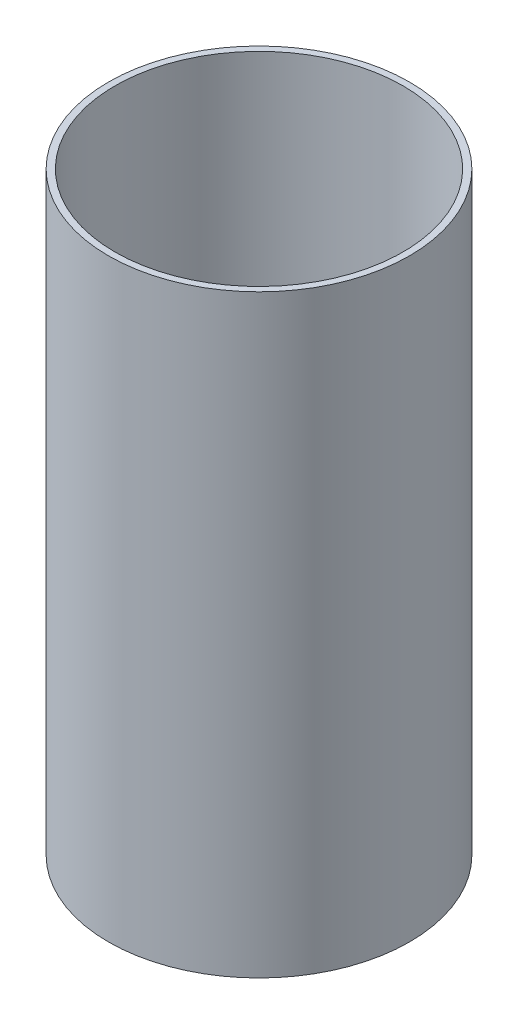
from build123d import *

# Parameters (mm, degrees)
ESQUISSE1_R        = 76
ESQUISSE1_R_2      = 72.7
BOSS_EXTRU_1_DEPTH = 300


with BuildPart() as part:
    # Esquisse1 → Boss.-Extru.1 (new body)
    with BuildSketch(Plane(origin=(0, 0, 0), x_dir=(1, 0, 0), z_dir=(0, 1, 0))):
        Circle(ESQUISSE1_R)
        Circle(ESQUISSE1_R_2, mode=Mode.SUBTRACT)
    extrude(amount=BOSS_EXTRU_1_DEPTH)


solid = part.part
